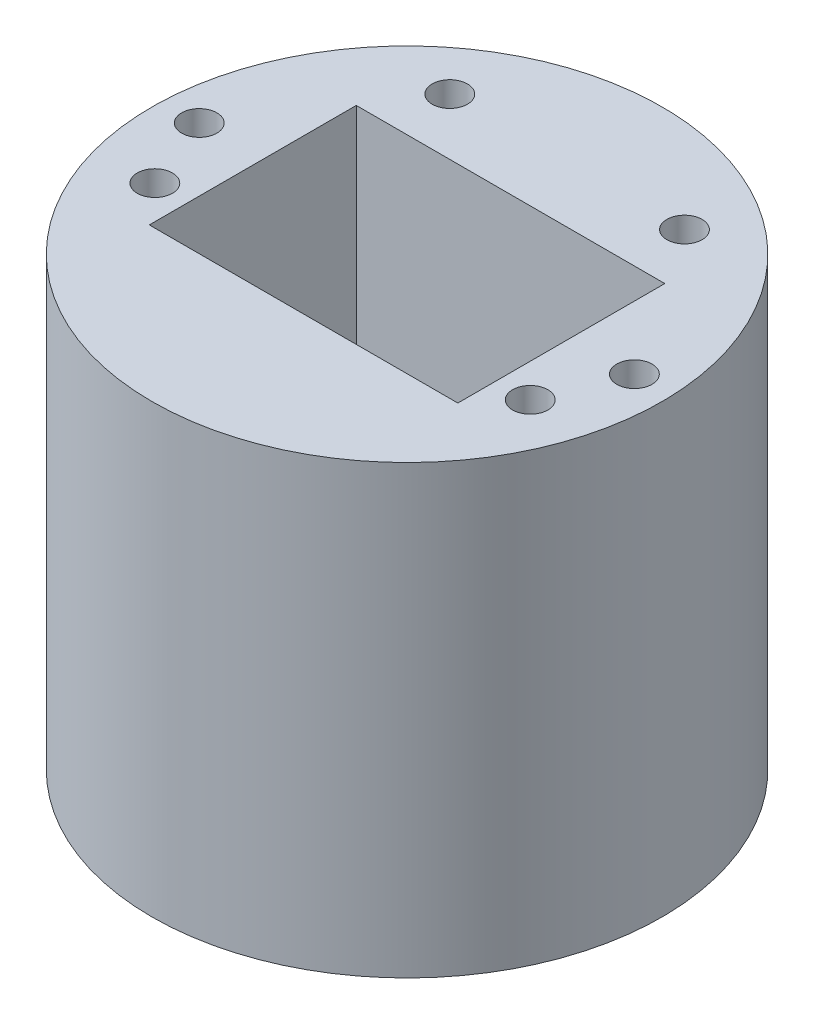
from build123d import *

# Parameters (mm, degrees)
SKETCH1_R           = 50.292
SKETCH1_R_2         = 3.475
BOSS_EXTRUDE1_DEPTH = 88
SKETCH2_W           = 60.822109288
SKETCH2_H           = 40.800022246
CUT_EXTRUDE1_DEPTH  = 68.04
SKETCH3_W           = 49.01906667
SKETCH3_H           = 20.847628368
CUT_EXTRUDE2_DEPTH  = 12


with BuildPart() as part:
    # Sketch1 → Boss-Extrude1 (new body)
    with BuildSketch(Plane(origin=(0, 0, 0), x_dir=(1, 0, 0), z_dir=(0, 1, 0))):
        Circle(SKETCH1_R)
        with Locations((-37.000474826, -12.718618748)):
            Circle(SKETCH1_R_2, mode=Mode.SUBTRACT)
        with Locations((37.000474826, -12.718618748)):
            Circle(SKETCH1_R_2, mode=Mode.SUBTRACT)
        with Locations((-42.886820356, 1.924977859)):
            Circle(SKETCH1_R_2, mode=Mode.SUBTRACT)
        with Locations((-23.129730363, 31.556520301)):
            Circle(SKETCH1_R_2, mode=Mode.SUBTRACT)
        with Locations((42.886820356, 1.924977859)):
            Circle(SKETCH1_R_2, mode=Mode.SUBTRACT)
        with Locations((23.129730363, 31.556520301)):
            Circle(SKETCH1_R_2, mode=Mode.SUBTRACT)
    extrude(amount=BOSS_EXTRUDE1_DEPTH)

    # Sketch2 → Cut-Extrude1 (cut)
    with BuildSketch(Plane(origin=(0, 88, 0), x_dir=(1, 0, 0), z_dir=(0, 1, 0))):
        Rectangle(SKETCH2_W, SKETCH2_H)
    extrude(amount=-CUT_EXTRUDE1_DEPTH, mode=Mode.SUBTRACT)

    # Sketch3 → Cut-Extrude2 (cut)
    with BuildSketch(Plane(origin=(0, 0, 0), x_dir=(-1, 0, 0), z_dir=(0, -1, 0))):
        Rectangle(SKETCH3_W, SKETCH3_H)
    extrude(amount=-CUT_EXTRUDE2_DEPTH, mode=Mode.SUBTRACT)


solid = part.part
